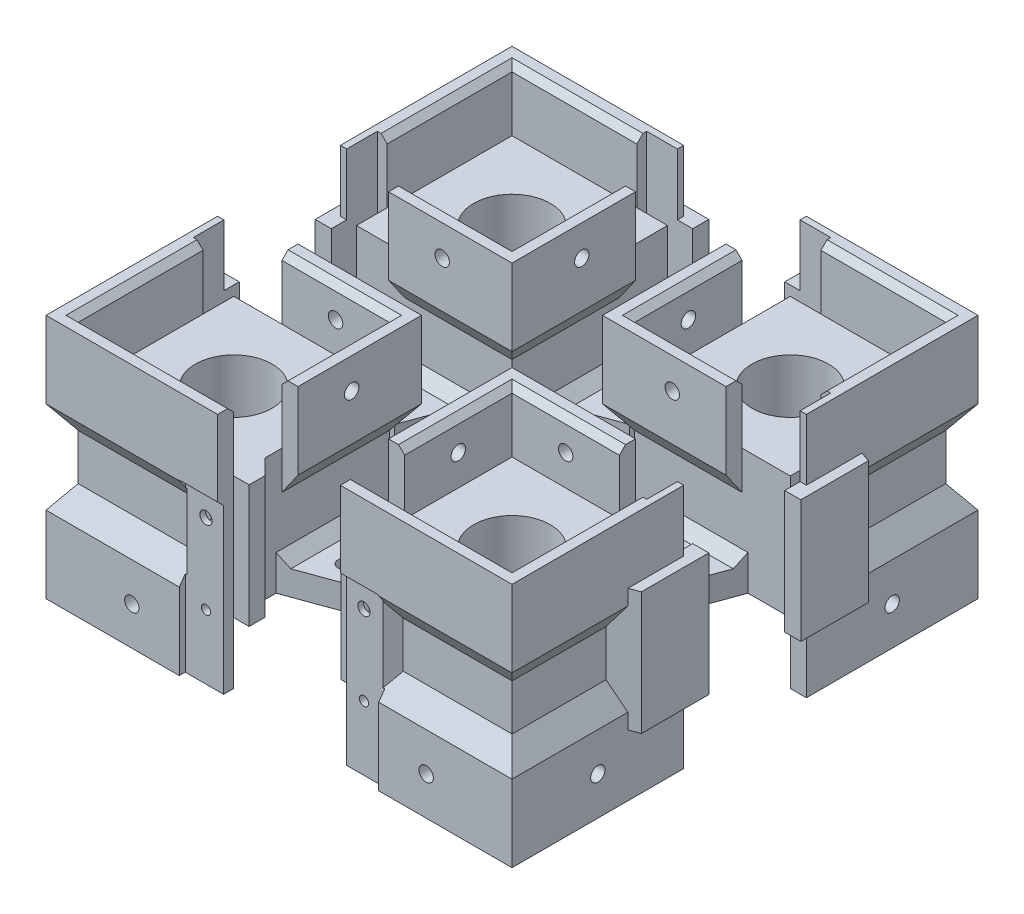
from build123d import *

# Parameters (mm, degrees)
SKETCH1_R                = 12.5
BOSS_EXTRUDE2_DEPTH      = 40
BOSS_EXTRUDE2_2_DEPTH    = 40
BOSS_EXTRUDE2_3_DEPTH    = 40
BOSS_EXTRUDE2_4_DEPTH    = 40
SKETCH1_7_R              = 2.35
BOSS_EXTRUDE3_DEPTH      = 8
BOSS_EXTRUDE4_DEPTH      = 20
BOSS_EXTRUDE4_DEPTH_BACK = 5
BOSS_EXTRUDE5_DEPTH      = 20
BOSS_EXTRUDE5_DEPTH_BACK = 5
CUT_EXTRUDE1_DEPTH       = 185.460022769
CUT_EXTRUDE1_DEPTH_BACK  = 10
SKETCH3_W                = 10
SKETCH3_H                = 3.2
SKETCH3_W_2              = 3.2
SKETCH3_H_2              = 10
CHAMFER5_SIZE            = 7.497777035
CHAMFER5_SIZE_2          = 5.25
CHAMFER6_SIZE            = 5.25
CHAMFER6_SIZE_2          = 7.497777035
CHAMFER7_SIZE            = 5.25
CHAMFER7_SIZE_2          = 7.497777035
CHAMFER8_SIZE            = 7.497777035
CHAMFER8_SIZE_2          = 5.25
CUT_EXTRUDE2_REACH       = 172.091
SKETCH6_R                = 2.35
CUT_EXTRUDE9_DEPTH       = 171.091071194
CUT_EXTRUDE9_DEPTH_BACK  = 171.091071194
SKETCH6_3_R              = 2.35
CUT_EXTRUDE3_REACH       = 172.091
SKETCH7_R                = 2.35
CUT_EXTRUDE10_DEPTH      = 171.091071194
CUT_EXTRUDE10_DEPTH_BACK = 171.091071194
SKETCH7_2_R              = 2.35
CUT_EXTRUDE4_START       = -3.75
CUT_EXTRUDE4_DEPTH       = 2.7
SKETCH8_3_R              = 2
CUT_EXTRUDE5_DEPTH       = 10
SKETCH8_7_R              = 1.5
CUT_EXTRUDE12_DEPTH      = 5
SKETCH9_W                = 65
SKETCH9_H                = 55.25
CUT_EXTRUDE8_DEPTH       = 1.95
CHAMFER9_SIZE            = 1.95
CHAMFER10_SIZE           = 1.95
CHAMFER11_SIZE           = 3.5
CHAMFER12_SIZE           = 3.5
CHAMFER13_SIZE           = 3.5
CHAMFER14_SIZE           = 3.5
CHAMFER15_SIZE           = 2
CHAMFER16_SIZE           = 2
CHAMFER17_SIZE           = 2
CHAMFER18_SIZE           = 2


# Some blends are built 0.0001 mm under size
with BuildPart() as part:
    # Sketch1 → Boss-Extrude2 (new body)
    with BuildSketch(Plane(origin=(0, 0, 0), x_dir=(1, 0, 0), z_dir=(0, 1, 0))):
        Polygon((15.35, 119.25), (15.35, 116.05), (25.35, 116.05), (25.35, 105.8), (25.35, 65.35), (-25.35, 65.35), (-25.35, 75.35), (-28.55, 75.35), (-28.55, 60.35), (-33.8, 60.35), (-33.8, 82.35), (-25.35, 85.42554848), (-25.35, 116.05), (5.27445152, 116.05), (8.35, 124.5), (30.35, 124.5), (30.35, 119.25), align=None)
        with Locations(Location((0, 90.7, 0), (0, 0, 270))):
            Circle(SKETCH1_R, mode=Mode.SUBTRACT)
    extrude(amount=BOSS_EXTRUDE2_DEPTH)



with BuildPart() as body_2:
    # Sketch1 → Boss-Extrude2 2 (new body)
    with BuildSketch(Plane(origin=(0, 0, 0), x_dir=(1, 0, 0), z_dir=(0, 1, 0))):
        Polygon((75.35, 116.05), (65.35, 116.05), (65.35, 105.8), (65.35, 65.35), (116.05, 65.35), (116.05, 75.35), (119.25, 75.35), (119.25, 60.35), (124.5, 60.35), (124.5, 82.35), (116.05, 85.42554848), (116.05, 116.05), (85.42554848, 116.05), (82.35, 124.5), (60.35, 124.5), (60.35, 119.25), (75.35, 119.25), align=None)
        with Locations(Location((90.7, 90.7, 0), (0, 0, 270))):
            Circle(SKETCH1_R, mode=Mode.SUBTRACT)
    extrude(amount=BOSS_EXTRUDE2_2_DEPTH)


with BuildPart() as body_3:
    # Sketch1 → Boss-Extrude2 3 (new body)
    with BuildSketch(Plane(origin=(0, 0, 0), x_dir=(1, 0, 0), z_dir=(0, 1, 0))):
        Polygon((-25.35, 15.35), (-25.35, 25.35), (25.35, 25.35), (25.35, -15.1), (30.35, -20.1), (30.35, -25.35), (25.35, -25.35), (25.35, -30.6), (15.35, -30.6), (10.1, -25.35), (-25.35, -25.35), (-25.35, 5.27445152), (-33.8, 8.35), (-33.8, 30.35), (-28.55, 30.35), (-28.55, 15.35), align=None)
        with Locations(Location((0, 0, 0), (0, 0, 270))):
            Circle(SKETCH1_R, mode=Mode.SUBTRACT)
    extrude(amount=BOSS_EXTRUDE2_3_DEPTH)


with BuildPart() as body_4:
    # Sketch1 → Boss-Extrude2 4 (new body)
    with BuildSketch(Plane(origin=(0, 0, 0), x_dir=(1, 0, 0), z_dir=(0, 1, 0))):
        Polygon((116.05, -25.35), (80.6, -25.35), (75.35, -30.6), (65.35, -30.6), (65.35, -25.35), (60.35, -25.35), (60.35, -20.1), (65.35, -15.1), (65.35, 25.35), (116.05, 25.35), (116.05, 15.35), (119.25, 15.35), (119.25, 30.35), (124.5, 30.35), (124.5, 8.35), (116.05, 5.27445152), align=None)
        with Locations(Location((90.7, 0, 0), (0, 0, 270))):
            Circle(SKETCH1_R, mode=Mode.SUBTRACT)
    extrude(amount=BOSS_EXTRUDE2_4_DEPTH)


with BuildPart() as part_1:
    add(part.part)

    add(body_2.part)  # Boss-Extrude3 merges body 2

    add(body_3.part)  # Boss-Extrude3 merges body 3

    add(body_4.part)  # Boss-Extrude3 merges body 4
    # Sketch1<7> → Boss-Extrude3 (add)
    # profile 1 of 8: a face of its own
    with BuildSketch(Plane(origin=(0, 0, 0), x_dir=(1, 0, 0), z_dir=(0, 1, 0))):
        Polygon((43.35, 95.7), (25.35, 102.251464217), (25.35, 79.148535783), (43.35, 85.7), align=None)
        with Locations(Location((36.35, 90.7, 0), (0, 0, 270))):
            Circle(SKETCH1_7_R, mode=Mode.SUBTRACT)
    # profile 2 of 8: a face of its own
    with BuildSketch(Plane(origin=(0, 0, 0), x_dir=(1, 0, 0), z_dir=(0, 1, 0))):
        Polygon((5, 47.35), (11.551464217, 65.35), (-11.551464217, 65.35), (-5, 47.35), align=None)
        with Locations(Location((0, 54.35, 0), (0, 0, 270))):
            Circle(SKETCH1_7_R, mode=Mode.SUBTRACT)
    # profile 3 of 8: a face of its own
    with BuildSketch(Plane(origin=(0, 0, 0), x_dir=(1, 0, 0), z_dir=(0, 1, 0))):
        Polygon((25.35, 11.551464217), (25.35, -11.551464217), (43.35, -5), (43.35, 5), align=None)
        with Locations(Location((36.35, 0, 0), (0, 0, 270))):
            Circle(SKETCH1_7_R, mode=Mode.SUBTRACT)
    # profile 4 of 8: a face of its own
    with BuildSketch(Plane(origin=(0, 0, 0), x_dir=(1, 0, 0), z_dir=(0, 1, 0))):
        Polygon((-5, 43.35), (-11.551464217, 25.35), (11.551464217, 25.35), (5, 43.35), align=None)
        with Locations(Location((0, 36.35, 0), (0, 0, 270))):
            Circle(SKETCH1_7_R, mode=Mode.SUBTRACT)
    # profile 5 of 8: a face of its own
    with BuildSketch(Plane(origin=(0, 0, 0), x_dir=(1, 0, 0), z_dir=(0, 1, 0))):
        Polygon((47.35, 5), (47.35, -5), (65.35, -11.551464217), (65.35, 11.551464217), align=None)
        with Locations(Location((54.35, 0, 0), (0, 0, 270))):
            Circle(SKETCH1_7_R, mode=Mode.SUBTRACT)
    # profile 6 of 8: a face of its own
    with BuildSketch(Plane(origin=(0, 0, 0), x_dir=(1, 0, 0), z_dir=(0, 1, 0))):
        Polygon((85.7, 43.35), (79.148535783, 25.35), (102.251464217, 25.35), (95.7, 43.35), align=None)
        with Locations(Location((90.7, 36.35, 0), (0, 0, 270))):
            Circle(SKETCH1_7_R, mode=Mode.SUBTRACT)
    # profile 7 of 8: a face of its own
    with BuildSketch(Plane(origin=(0, 0, 0), x_dir=(1, 0, 0), z_dir=(0, 1, 0))):
        Polygon((102.251464217, 65.35), (79.148535783, 65.35), (85.7, 47.35), (95.7, 47.35), align=None)
        with Locations(Location((90.7, 54.35, 0), (0, 0, 270))):
            Circle(SKETCH1_7_R, mode=Mode.SUBTRACT)
    # profile 8 of 8: a face of its own
    with BuildSketch(Plane(origin=(0, 0, 0), x_dir=(1, 0, 0), z_dir=(0, 1, 0))):
        Polygon((65.35, 79.148535783), (65.35, 102.251464217), (47.35, 95.7), (47.35, 85.7), align=None)
        with Locations(Location((54.35, 90.7, 0), (0, 0, 270))):
            Circle(SKETCH1_7_R, mode=Mode.SUBTRACT)
    extrude(amount=BOSS_EXTRUDE3_DEPTH)

    # Sketch2 → Boss-Extrude4 (add, two sides: drawn at the far end of the back side and taken through both)
    with BuildSketch(Plane.XZ.offset(-BOSS_EXTRUDE4_DEPTH_BACK)):
        Polygon((25.35, 30.6), (25.35, 25.35), (-25.35, 25.35), (-25.35, -25.35), (-30.6, -25.35), (-30.6, 30.6), align=None)
        Polygon((-25.35, -116.05), (-25.35, -65.35), (-30.6, -65.35), (-30.6, -121.3), (25.35, -121.3), (25.35, -116.05), align=None)
        Polygon((65.35, -121.3), (65.35, -116.05), (116.05, -116.05), (116.05, -65.35), (121.3, -65.35), (121.3, -121.3), align=None)
        Polygon((116.05, 25.35), (116.05, -25.35), (121.3, -25.35), (121.3, 30.6), (65.35, 30.6), (65.35, 25.35), align=None)
    extrude(amount=BOSS_EXTRUDE4_DEPTH + BOSS_EXTRUDE4_DEPTH_BACK)

    # Sketch4 → Boss-Extrude5 (add, two sides: drawn at the far end of the back side and taken through both)
    with BuildSketch(Plane(origin=(0, 40, 0), x_dir=(1, 0, 0), z_dir=(0, 1, 0)).offset(-BOSS_EXTRUDE5_DEPTH_BACK)):
        Polygon((-25.35, -25.35), (-25.35, 5.27445152), (-30.6, 7.18529525), (-30.6, -30.6), (15.35, -30.6), (10.1, -25.35), align=None)
        Polygon((-28.55, 15.35), (-28.55, 25.35), (-30.6, 25.35), (-30.6, 7.18529525), (-25.35, 5.27445152), (-25.35, 15.35), align=None)
        Polygon((25.35, -25.35), (10.1, -25.35), (15.35, -30.6), (25.35, -30.6), align=None)
        Polygon((25.35, 25.35), (25.35, -9.65), (30.6, -9.65), (30.6, 30.6), (-9.65, 30.6), (-9.65, 25.35), align=None)
        Polygon((25.35, 100.35), (30.6, 100.35), (30.6, 60.1), (-9.65, 60.1), (-9.65, 65.35), (25.35, 65.35), align=None)
        Polygon((-25.35, 65.35), (-25.35, 116.05), (25.35, 116.05), (25.35, 121.3), (-30.6, 121.3), (-30.6, 65.35), align=None)
        Polygon((65.35, -9.65), (60.1, -9.65), (60.1, 30.6), (100.35, 30.6), (100.35, 25.35), (65.35, 25.35), align=None)
        Polygon((116.05, 25.35), (116.05, -25.35), (65.35, -25.35), (65.35, -30.6), (121.3, -30.6), (121.3, 25.35), align=None)
        Polygon((100.35, 60.1), (100.35, 65.35), (65.35, 65.35), (65.35, 100.35), (60.1, 100.35), (60.1, 60.1), align=None)
        Polygon((121.3, 65.35), (121.3, 121.3), (65.35, 121.3), (65.35, 116.05), (116.05, 116.05), (116.05, 65.35), align=None)
    extrude(amount=BOSS_EXTRUDE5_DEPTH + BOSS_EXTRUDE5_DEPTH_BACK)

    # Sketch3 → Cut-Extrude1 (cut, two sides: drawn at the far end of the back side and taken through both)
    with BuildSketch(Plane(origin=(0, 5, 0), x_dir=(1, 0, 0), z_dir=(0, 1, 0)).offset(-CUT_EXTRUDE1_DEPTH_BACK)):
        with Locations((20.35, 117.65)):
            Rectangle(SKETCH3_W, SKETCH3_H)
        with Locations((-26.95, 70.35)):
            Rectangle(SKETCH3_W_2, SKETCH3_H_2)
        with Locations((-26.95, 20.35)):
            Rectangle(SKETCH3_W_2, SKETCH3_H_2)
        with Locations((117.65, 20.35)):
            Rectangle(SKETCH3_W_2, SKETCH3_H_2)
        with Locations((117.65, 70.35)):
            Rectangle(SKETCH3_W_2, SKETCH3_H_2)
        with Locations((70.35, 117.65)):
            Rectangle(SKETCH3_W, SKETCH3_H)
    extrude(amount=CUT_EXTRUDE1_DEPTH + CUT_EXTRUDE1_DEPTH_BACK, mode=Mode.SUBTRACT)

    # Chamfer5
    # the kernel refuses this chamfer: 7.497777035, 5.25 mm, written as the material it adds along each edge
    with BuildSketch(Plane(origin=(-25.35, 35, -66.062147675), x_dir=(0, -1, 0), z_dir=(0, 0, -1))) as chamfer5_piece_1_section:
        Polygon((CHAMFER5_SIZE, 0), (0, CHAMFER5_SIZE_2), (0, 0), align=None)
    chamfer5_piece_1 = extrude(amount=69.35125313, mode=Mode.PRIVATE)
    chamfer5_piece_1 = split(chamfer5_piece_1, bisect_by=Plane(origin=(-25.35, 35, -75.35), z_dir=(0, 0, -1)), keep=Keep.TOP, mode=Mode.PRIVATE)
    chamfer5_piece_1 = split(chamfer5_piece_1, bisect_by=Plane(origin=(-25.35, 9.046698891, -103.127302922), z_dir=(0, 0.5735764363510435, 0.8191520442889937)), keep=Keep.TOP, mode=Mode.PRIVATE)
    add(chamfer5_piece_1)
    with BuildSketch(Plane(origin=(-44.713400805, 35, -116.05), x_dir=(0, -1, 0), z_dir=(1, 0, 0))) as chamfer5_piece_2_section:
        Polygon((CHAMFER5_SIZE, 0), (0, CHAMFER5_SIZE_2), (0, 0), align=None)
    chamfer5_piece_2 = extrude(amount=69.35125313, mode=Mode.PRIVATE)
    chamfer5_piece_2 = split(chamfer5_piece_2, bisect_by=Plane(origin=(15.35, 35, -116.05), z_dir=(-1, 0, 0)), keep=Keep.TOP, mode=Mode.PRIVATE)
    chamfer5_piece_2 = split(chamfer5_piece_2, bisect_by=Plane(origin=(-35.243166719, 41.631129295, -116.05), z_dir=(0.8191520442889937, 0.5735764363510435, 0)), keep=Keep.TOP, mode=Mode.PRIVATE)
    add(chamfer5_piece_2)
    with BuildSketch(Plane(origin=(24.637852325, 5, -116.05), x_dir=(0, 0, -1), z_dir=(-1, 0, 0))) as chamfer5_piece_3_section:
        Polygon((CHAMFER5_SIZE_2, 0), (0, -CHAMFER5_SIZE), (0, 0), align=None)
    chamfer5_piece_3 = extrude(amount=69.35125313, mode=Mode.PRIVATE)
    chamfer5_piece_3 = split(chamfer5_piece_3, bisect_by=Plane(origin=(15.35, 5, -116.05), z_dir=(-1, 0, 0)), keep=Keep.TOP, mode=Mode.PRIVATE)
    chamfer5_piece_3 = split(chamfer5_piece_3, bisect_by=Plane(origin=(-12.427302922, 30.953301109, -116.05), z_dir=(0.8191520442889938, -0.5735764363510434, 0)), keep=Keep.TOP, mode=Mode.PRIVATE)
    add(chamfer5_piece_3)
    with BuildSketch(Plane(origin=(-25.35, 5, -135.413400805), x_dir=(-1, 0, 0), z_dir=(0, 0, 1))) as chamfer5_piece_4_section:
        Polygon((CHAMFER5_SIZE_2, 0), (0, -CHAMFER5_SIZE), (0, 0), align=None)
    chamfer5_piece_4 = extrude(amount=69.35125313, mode=Mode.PRIVATE)
    chamfer5_piece_4 = split(chamfer5_piece_4, bisect_by=Plane(origin=(-25.35, 5, -75.35), z_dir=(0, 0, -1)), keep=Keep.TOP, mode=Mode.PRIVATE)
    chamfer5_piece_4 = split(chamfer5_piece_4, bisect_by=Plane(origin=(-25.35, -1.631129295, -125.943166719), z_dir=(0, -0.5735764363510434, 0.8191520442889938)), keep=Keep.TOP, mode=Mode.PRIVATE)
    add(chamfer5_piece_4)
    with BuildSketch(Plane(origin=(-9.65, 35, -65.35), x_dir=(0, 0, 1), z_dir=(1, 0, 0))) as chamfer5_piece_5_section:
        Polygon((CHAMFER5_SIZE_2, 0), (0, CHAMFER5_SIZE), (0, 0), align=None)
    chamfer5_piece_5 = extrude(amount=54.363400805, mode=Mode.PRIVATE)
    chamfer5_piece_5 = split(chamfer5_piece_5, bisect_by=Plane(origin=(17.358155384, 16.088686007, -65.35), z_dir=(-0.8191520442889962, 0.5735764363510398, 0)), keep=Keep.TOP, mode=Mode.PRIVATE)
    add(chamfer5_piece_5)
    with BuildSketch(Plane(origin=(25.35, 35, -45.986599195), x_dir=(1, 0, 0), z_dir=(0, 0, -1))) as chamfer5_piece_6_section:
        Polygon((CHAMFER5_SIZE_2, 0), (0, CHAMFER5_SIZE), (0, 0), align=None)
    chamfer5_piece_6 = extrude(amount=54.363400805, mode=Mode.PRIVATE)
    chamfer5_piece_6 = split(chamfer5_piece_6, bisect_by=Plane(origin=(25.35, 41.631129295, -55.456833281), z_dir=(0, 0.5735764363510445, -0.8191520442889929)), keep=Keep.TOP, mode=Mode.PRIVATE)
    add(chamfer5_piece_6)

    # Chamfer6
    # the kernel refuses this chamfer: 7.497777035, 5.25 mm, written as the material it adds along each edge
    with BuildSketch(Plane(origin=(116.05, 5, -135.413400805), x_dir=(1, 0, 0), z_dir=(0, 0, 1))) as chamfer6_piece_1_section:
        Polygon((CHAMFER6_SIZE, 0), (0, CHAMFER6_SIZE_2), (0, 0), align=None)
    chamfer6_piece_1 = extrude(amount=69.35125313, mode=Mode.PRIVATE)
    chamfer6_piece_1 = split(chamfer6_piece_1, bisect_by=Plane(origin=(116.05, 5, -75.35), z_dir=(0, 0, -1)), keep=Keep.TOP, mode=Mode.PRIVATE)
    chamfer6_piece_1 = split(chamfer6_piece_1, bisect_by=Plane(origin=(116.05, -1.631129295, -125.94316672), z_dir=(0, -0.5735764363593767, 0.8191520442831587)), keep=Keep.TOP, mode=Mode.PRIVATE)
    add(chamfer6_piece_1)
    with BuildSketch(Plane(origin=(66.062147675, 5, -116.05), x_dir=(0, 0, -1), z_dir=(1, 0, 0))) as chamfer6_piece_2_section:
        Polygon((CHAMFER6_SIZE, 0), (-CHAMFER6_SIZE_2 * 1.51589485099e-11, CHAMFER6_SIZE_2), (0, 0), align=None)
    chamfer6_piece_2 = extrude(amount=69.35125313, mode=Mode.PRIVATE)
    chamfer6_piece_2 = split(chamfer6_piece_2, bisect_by=Plane(origin=(75.35, 5, -116.05), z_dir=(1, 0, 0)), keep=Keep.TOP, mode=Mode.PRIVATE)
    chamfer6_piece_2 = split(chamfer6_piece_2, bisect_by=Plane(origin=(103.127302922, 30.953301109, -116.05), z_dir=(-0.8191520442889938, -0.5735764363510434, 0)), keep=Keep.TOP, mode=Mode.PRIVATE)
    add(chamfer6_piece_2)
    with BuildSketch(Plane(origin=(116.05, 35, -135.413400805), x_dir=(1, 0, 0), z_dir=(0, 0, 1))) as chamfer6_piece_3_section:
        Polygon((CHAMFER6_SIZE, 0), (0, -CHAMFER6_SIZE_2), (0, 0), align=None)
    chamfer6_piece_3 = extrude(amount=69.35125313, mode=Mode.PRIVATE)
    chamfer6_piece_3 = split(chamfer6_piece_3, bisect_by=Plane(origin=(116.05, 35, -75.35), z_dir=(0, 0, -1)), keep=Keep.TOP, mode=Mode.PRIVATE)
    chamfer6_piece_3 = split(chamfer6_piece_3, bisect_by=Plane(origin=(116.05, 41.631129295, -125.94316672), z_dir=(0, 0.5735764363593768, 0.8191520442831587)), keep=Keep.TOP, mode=Mode.PRIVATE)
    add(chamfer6_piece_3)
    with BuildSketch(Plane(origin=(66.062147675, 35, -116.05), x_dir=(0, 0, -1), z_dir=(1, 0, 0))) as chamfer6_piece_4_section:
        Polygon((CHAMFER6_SIZE, 0), (-CHAMFER6_SIZE_2 * 1.51589485099e-11, -CHAMFER6_SIZE_2), (0, 0), align=None)
    chamfer6_piece_4 = extrude(amount=69.35125313, mode=Mode.PRIVATE)
    chamfer6_piece_4 = split(chamfer6_piece_4, bisect_by=Plane(origin=(75.35, 35, -116.05), z_dir=(1, 0, 0)), keep=Keep.TOP, mode=Mode.PRIVATE)
    chamfer6_piece_4 = split(chamfer6_piece_4, bisect_by=Plane(origin=(103.127302922, 9.046698891, -116.05), z_dir=(-0.8191520442889937, 0.5735764363510435, 0)), keep=Keep.TOP, mode=Mode.PRIVATE)
    add(chamfer6_piece_4)
    with BuildSketch(Plane(origin=(65.35, 35, -45.986599195), x_dir=(-1, 0, 0), z_dir=(0, 0, -1))) as chamfer6_piece_5_section:
        Polygon((CHAMFER6_SIZE, 0), (0, -CHAMFER6_SIZE_2), (0, 0), align=None)
    chamfer6_piece_5 = extrude(amount=54.363400805, mode=Mode.PRIVATE)
    chamfer6_piece_5 = split(chamfer6_piece_5, bisect_by=Plane(origin=(65.35, 41.631129295, -55.456833281), z_dir=(0, 0.5735764363510456, -0.8191520442889922)), keep=Keep.TOP, mode=Mode.PRIVATE)
    add(chamfer6_piece_5)
    with BuildSketch(Plane(origin=(100.35, 35, -65.35), x_dir=(0, 0, 1), z_dir=(-1, 0, 0))) as chamfer6_piece_6_section:
        Polygon((CHAMFER6_SIZE, 0), (0, -CHAMFER6_SIZE_2), (0, 0), align=None)
    chamfer6_piece_6 = extrude(amount=54.363400805, mode=Mode.PRIVATE)
    chamfer6_piece_6 = split(chamfer6_piece_6, bisect_by=Plane(origin=(73.341844616, 16.088686007, -65.35), z_dir=(0.8191520442889944, 0.5735764363510424, 0)), keep=Keep.TOP, mode=Mode.PRIVATE)
    add(chamfer6_piece_6)

    # Chamfer7
    # the kernel refuses this chamfer: 7.497777035, 5.25 mm, written as the material it adds along each edge
    with BuildSketch(Plane(origin=(116.05, 35, -24.637852325), x_dir=(1, 0, 0), z_dir=(0, 0, 1))) as chamfer7_piece_1_section:
        Polygon((CHAMFER7_SIZE, 0), (0, -CHAMFER7_SIZE_2), (0, 0), align=None)
    chamfer7_piece_1 = extrude(amount=69.35125313, mode=Mode.PRIVATE)
    chamfer7_piece_1 = split(chamfer7_piece_1, bisect_by=Plane(origin=(116.05, 35, -15.35), z_dir=(0, 0, 1)), keep=Keep.TOP, mode=Mode.PRIVATE)
    chamfer7_piece_1 = split(chamfer7_piece_1, bisect_by=Plane(origin=(116.05, 9.046698891, 12.427302922), z_dir=(0, 0.5735764363427109, -0.8191520442948282)), keep=Keep.TOP, mode=Mode.PRIVATE)
    add(chamfer7_piece_1)
    with BuildSketch(Plane(origin=(135.413400805, 35, 25.35), x_dir=(0, 0, 1), z_dir=(-1, 0, 0))) as chamfer7_piece_2_section:
        Polygon((CHAMFER7_SIZE, 0), (CHAMFER7_SIZE_2 * 1.51608438523e-11, -CHAMFER7_SIZE_2), (0, 0), align=None)
    chamfer7_piece_2 = extrude(amount=74.17680161, mode=Mode.PRIVATE)
    chamfer7_piece_2 = split(chamfer7_piece_2, bisect_by=Plane(origin=(65.35, 35, 25.35), z_dir=(1, 0, 0)), keep=Keep.TOP, mode=Mode.PRIVATE)
    chamfer7_piece_2 = split(chamfer7_piece_2, bisect_by=Plane(origin=(125.943166719, 41.631129295, 25.35), z_dir=(-0.8191520442889922, 0.5735764363510456, 0)), keep=Keep.TOP, mode=Mode.PRIVATE)
    add(chamfer7_piece_2)
    with BuildSketch(Plane(origin=(116.05, 5, 44.713400805), x_dir=(0, 1, 0), z_dir=(0, 0, -1))) as chamfer7_piece_3_section:
        Polygon((CHAMFER7_SIZE_2, 0), (0, CHAMFER7_SIZE), (0, 0), align=None)
    chamfer7_piece_3 = extrude(amount=69.35125313, mode=Mode.PRIVATE)
    chamfer7_piece_3 = split(chamfer7_piece_3, bisect_by=Plane(origin=(116.05, 5, -15.35), z_dir=(0, 0, 1)), keep=Keep.TOP, mode=Mode.PRIVATE)
    chamfer7_piece_3 = split(chamfer7_piece_3, bisect_by=Plane(origin=(116.05, -1.631129295, 35.243166719), z_dir=(0, -0.5735764363427114, -0.8191520442948279)), keep=Keep.TOP, mode=Mode.PRIVATE)
    add(chamfer7_piece_3)
    with BuildSketch(Plane(origin=(61.236599195, 5, 25.35), x_dir=(0, 0, 1), z_dir=(1, 0, 0))) as chamfer7_piece_4_section:
        Polygon((CHAMFER7_SIZE, 0), (CHAMFER7_SIZE_2 * 1.51608438523e-11, -CHAMFER7_SIZE_2), (0, 0), align=None)
    chamfer7_piece_4 = extrude(amount=74.17680161, mode=Mode.PRIVATE)
    chamfer7_piece_4 = split(chamfer7_piece_4, bisect_by=Plane(origin=(65.35, 5, 25.35), z_dir=(1, 0, 0)), keep=Keep.TOP, mode=Mode.PRIVATE)
    chamfer7_piece_4 = split(chamfer7_piece_4, bisect_by=Plane(origin=(101.539746073, 33.220567258, 25.35), z_dir=(-0.8191520442889924, -0.5735764363510455, 0)), keep=Keep.TOP, mode=Mode.PRIVATE)
    add(chamfer7_piece_4)
    with BuildSketch(Plane(origin=(65.35, 35, -44.713400805), x_dir=(-1, 0, 0), z_dir=(0, 0, 1))) as chamfer7_piece_5_section:
        Polygon((CHAMFER7_SIZE, 0), (0, CHAMFER7_SIZE_2), (0, 0), align=None)
    chamfer7_piece_5 = extrude(amount=54.363400805, mode=Mode.PRIVATE)
    chamfer7_piece_5 = split(chamfer7_piece_5, bisect_by=Plane(origin=(65.35, 41.631129295, -35.243166719), z_dir=(0, 0.5735764363510442, 0.8191520442889931)), keep=Keep.TOP, mode=Mode.PRIVATE)
    add(chamfer7_piece_5)
    with BuildSketch(Plane(origin=(100.35, 35, -25.35), x_dir=(0, 0, -1), z_dir=(-1, 0, 0))) as chamfer7_piece_6_section:
        Polygon((CHAMFER7_SIZE, 0), (0, CHAMFER7_SIZE_2), (0, 0), align=None)
    chamfer7_piece_6 = extrude(amount=54.363400805, mode=Mode.PRIVATE)
    chamfer7_piece_6 = split(chamfer7_piece_6, bisect_by=Plane(origin=(73.341844616, 16.088686007, -25.35), z_dir=(0.8191520442889929, 0.5735764363510445, 0)), keep=Keep.TOP, mode=Mode.PRIVATE)
    add(chamfer7_piece_6)

    # Chamfer8
    # the kernel refuses this chamfer: 7.497777035, 5.25 mm, written as the material it adds along each edge
    with BuildSketch(Plane(origin=(-25.35, 5, 44.713400805), x_dir=(0, 1, 0), z_dir=(0, 0, -1))) as chamfer8_piece_1_section:
        Polygon((CHAMFER8_SIZE, 0), (0, -CHAMFER8_SIZE_2), (0, 0), align=None)
    chamfer8_piece_1 = extrude(amount=69.35125313, mode=Mode.PRIVATE)
    chamfer8_piece_1 = split(chamfer8_piece_1, bisect_by=Plane(origin=(-25.35, 5, -15.35), z_dir=(0, 0, 1)), keep=Keep.TOP, mode=Mode.PRIVATE)
    chamfer8_piece_1 = split(chamfer8_piece_1, bisect_by=Plane(origin=(-25.35, -1.631129295, 35.243166719), z_dir=(0, -0.5735764363510445, -0.8191520442889929)), keep=Keep.TOP, mode=Mode.PRIVATE)
    add(chamfer8_piece_1)
    with BuildSketch(Plane(origin=(29.463400805, 5, 25.35), x_dir=(0, 1, 0), z_dir=(-1, 0, 0))) as chamfer8_piece_2_section:
        Polygon((CHAMFER8_SIZE, 0), (0, -CHAMFER8_SIZE_2), (0, 0), align=None)
    chamfer8_piece_2 = extrude(amount=74.17680161, mode=Mode.PRIVATE)
    chamfer8_piece_2 = split(chamfer8_piece_2, bisect_by=Plane(origin=(19.781700402, 5, 35.031700402), z_dir=(-0.7071067811865436, 0, 0.7071067811865515)), keep=Keep.TOP, mode=Mode.PRIVATE)
    chamfer8_piece_2 = split(chamfer8_piece_2, bisect_by=Plane(origin=(-10.839746073, 33.220567258, 25.35), z_dir=(0.8191520442889929, -0.5735764363510445, 0)), keep=Keep.TOP, mode=Mode.PRIVATE)
    add(chamfer8_piece_2)
    with BuildSketch(Plane(origin=(-25.35, 35, -24.637852325), x_dir=(0, -1, 0), z_dir=(0, 0, 1))) as chamfer8_piece_3_section:
        Polygon((CHAMFER8_SIZE, 0), (0, -CHAMFER8_SIZE_2), (0, 0), align=None)
    chamfer8_piece_3 = extrude(amount=69.35125313, mode=Mode.PRIVATE)
    chamfer8_piece_3 = split(chamfer8_piece_3, bisect_by=Plane(origin=(-25.35, 35, -15.35), z_dir=(0, 0, 1)), keep=Keep.TOP, mode=Mode.PRIVATE)
    chamfer8_piece_3 = split(chamfer8_piece_3, bisect_by=Plane(origin=(-25.35, 9.046698891, 12.427302922), z_dir=(0, 0.5735764363510445, -0.8191520442889929)), keep=Keep.TOP, mode=Mode.PRIVATE)
    add(chamfer8_piece_3)
    with BuildSketch(Plane(origin=(-44.713400805, 35, 25.35), x_dir=(0, -1, 0), z_dir=(1, 0, 0))) as chamfer8_piece_4_section:
        Polygon((CHAMFER8_SIZE, 0), (0, -CHAMFER8_SIZE_2), (0, 0), align=None)
    chamfer8_piece_4 = extrude(amount=74.17680161, mode=Mode.PRIVATE)
    chamfer8_piece_4 = split(chamfer8_piece_4, bisect_by=Plane(origin=(-17.306700402, 35, -2.056700402), z_dir=(-0.7071067811865436, 0, 0.7071067811865515)), keep=Keep.TOP, mode=Mode.PRIVATE)
    chamfer8_piece_4 = split(chamfer8_piece_4, bisect_by=Plane(origin=(-35.243166719, 41.631129295, 25.35), z_dir=(0.8191520442889929, 0.5735764363510445, 0)), keep=Keep.TOP, mode=Mode.PRIVATE)
    add(chamfer8_piece_4)
    with BuildSketch(Plane(origin=(-9.65, 35, -25.35), x_dir=(0, 0, -1), z_dir=(1, 0, 0))) as chamfer8_piece_5_section:
        Polygon((CHAMFER8_SIZE_2, 0), (0, -CHAMFER8_SIZE), (0, 0), align=None)
    chamfer8_piece_5 = extrude(amount=54.363400805, mode=Mode.PRIVATE)
    chamfer8_piece_5 = split(chamfer8_piece_5, bisect_by=Plane(origin=(17.358155384, 16.088686007, -25.35), z_dir=(-0.8191520442889929, 0.5735764363510445, 0)), keep=Keep.TOP, mode=Mode.PRIVATE)
    add(chamfer8_piece_5)
    with BuildSketch(Plane(origin=(25.35, 35, -44.713400805), x_dir=(1, 0, 0), z_dir=(0, 0, 1))) as chamfer8_piece_6_section:
        Polygon((CHAMFER8_SIZE_2, 0), (0, -CHAMFER8_SIZE), (0, 0), align=None)
    chamfer8_piece_6 = extrude(amount=54.363400805, mode=Mode.PRIVATE)
    chamfer8_piece_6 = split(chamfer8_piece_6, bisect_by=Plane(origin=(25.35, 41.631129295, -35.243166719), z_dir=(0, 0.5735764363510445, 0.8191520442889929)), keep=Keep.TOP, mode=Mode.PRIVATE)
    add(chamfer8_piece_6)

    # Cut-Extrude2: up to this face of the body (flat: up to its plane)
    cut_extrude2_end = Plane(part_1.part.faces().sort_by_distance((82.85, 50, -65.35))[0])
    # Sketch6 → Cut-Extrude2 (cut, up to the picked face)
    with BuildSketch(Plane.XY.offset(-25.35), mode=Mode.PRIVATE) as cut_extrude2_sk1:
        with Locations((7.85, 50)):
            Circle(SKETCH6_R)
    cut_extrude2_tool1 = split(extrude(cut_extrude2_sk1.sketch, amount=-CUT_EXTRUDE2_REACH, mode=Mode.PRIVATE), bisect_by=cut_extrude2_end, keep=Keep.BOTH, mode=Mode.PRIVATE)
    # Sketch6 → Cut-Extrude2 (cut, up to the picked face)
    with BuildSketch(Plane.XY.offset(-25.35), mode=Mode.PRIVATE) as cut_extrude2_sk2:
        with Locations((82.85, 50)):
            Circle(SKETCH6_R)
    cut_extrude2_tool2 = split(extrude(cut_extrude2_sk2.sketch, amount=-CUT_EXTRUDE2_REACH, mode=Mode.PRIVATE), bisect_by=cut_extrude2_end, keep=Keep.BOTH, mode=Mode.PRIVATE)
    # Sketch6 → Cut-Extrude2 (cut, up to the picked face)
    with BuildSketch(Plane.XY.offset(-25.35), mode=Mode.PRIVATE) as cut_extrude2_sk3:
        with Locations((-2.625, -7.5)):
            Circle(SKETCH6_R)
    cut_extrude2_tool3 = split(extrude(cut_extrude2_sk3.sketch, amount=-CUT_EXTRUDE2_REACH, mode=Mode.PRIVATE), bisect_by=cut_extrude2_end, keep=Keep.BOTH, mode=Mode.PRIVATE)
    # Sketch6 → Cut-Extrude2 (cut, up to the picked face)
    with BuildSketch(Plane.XY.offset(-25.35), mode=Mode.PRIVATE) as cut_extrude2_sk4:
        with Locations((93.325, -7.5)):
            Circle(SKETCH6_R)
    cut_extrude2_tool4 = split(extrude(cut_extrude2_sk4.sketch, amount=-CUT_EXTRUDE2_REACH, mode=Mode.PRIVATE), bisect_by=cut_extrude2_end, keep=Keep.BOTH, mode=Mode.PRIVATE)
    add(cut_extrude2_tool1.solids().sort_by(Axis((7.85, 50, -25.35), (0, 0, -1)))[0], mode=Mode.SUBTRACT)
    add(cut_extrude2_tool2.solids().sort_by(Axis((82.85, 50, -25.35), (0, 0, -1)))[0], mode=Mode.SUBTRACT)
    add(cut_extrude2_tool3.solids().sort_by(Axis((-2.625, -7.5, -25.35), (0, 0, -1)))[0], mode=Mode.SUBTRACT)
    add(cut_extrude2_tool4.solids().sort_by(Axis((93.325, -7.5, -25.35), (0, 0, -1)))[0], mode=Mode.SUBTRACT)

    # Sketch6<3> → Cut-Extrude9 (cut, two sides: drawn at the far end of the back side and taken through both)
    with BuildSketch(Plane.XY.offset(-25.35).offset(-CUT_EXTRUDE9_DEPTH_BACK)):
        with Locations((-2.625, -7.5)):
            Circle(SKETCH6_3_R)
        with Locations((93.325, -7.5)):
            Circle(SKETCH6_3_R)
    extrude(amount=CUT_EXTRUDE9_DEPTH + CUT_EXTRUDE9_DEPTH_BACK, mode=Mode.SUBTRACT)

    # Cut-Extrude3: up to this face of the body (flat: up to its plane)
    cut_extrude3_end = Plane(part_1.part.faces().sort_by_distance((25.35, 50, -7.85))[0])
    # Sketch7 → Cut-Extrude3 (cut, up to the picked face)
    with BuildSketch(Plane(origin=(65.35, 0, 0), x_dir=(0, 0, -1), z_dir=(1, 0, 0)), mode=Mode.PRIVATE) as cut_extrude3_sk1:
        with Locations((7.85, 50)):
            Circle(SKETCH7_R)
    cut_extrude3_tool1 = split(extrude(cut_extrude3_sk1.sketch, amount=-CUT_EXTRUDE3_REACH, mode=Mode.PRIVATE), bisect_by=cut_extrude3_end, keep=Keep.BOTH, mode=Mode.PRIVATE)
    # Sketch7 → Cut-Extrude3 (cut, up to the picked face)
    with BuildSketch(Plane(origin=(65.35, 0, 0), x_dir=(0, 0, -1), z_dir=(1, 0, 0)), mode=Mode.PRIVATE) as cut_extrude3_sk2:
        with Locations((82.85, 50)):
            Circle(SKETCH7_R)
    cut_extrude3_tool2 = split(extrude(cut_extrude3_sk2.sketch, amount=-CUT_EXTRUDE3_REACH, mode=Mode.PRIVATE), bisect_by=cut_extrude3_end, keep=Keep.BOTH, mode=Mode.PRIVATE)
    # Sketch7 → Cut-Extrude3 (cut, up to the picked face)
    with BuildSketch(Plane(origin=(65.35, 0, 0), x_dir=(0, 0, -1), z_dir=(1, 0, 0)), mode=Mode.PRIVATE) as cut_extrude3_sk3:
        with Locations((-2.625, -7.5)):
            Circle(SKETCH7_R)
    cut_extrude3_tool3 = split(extrude(cut_extrude3_sk3.sketch, amount=-CUT_EXTRUDE3_REACH, mode=Mode.PRIVATE), bisect_by=cut_extrude3_end, keep=Keep.BOTH, mode=Mode.PRIVATE)
    # Sketch7 → Cut-Extrude3 (cut, up to the picked face)
    with BuildSketch(Plane(origin=(65.35, 0, 0), x_dir=(0, 0, -1), z_dir=(1, 0, 0)), mode=Mode.PRIVATE) as cut_extrude3_sk4:
        with Locations((93.325, -7.5)):
            Circle(SKETCH7_R)
    cut_extrude3_tool4 = split(extrude(cut_extrude3_sk4.sketch, amount=-CUT_EXTRUDE3_REACH, mode=Mode.PRIVATE), bisect_by=cut_extrude3_end, keep=Keep.BOTH, mode=Mode.PRIVATE)
    add(cut_extrude3_tool1.solids().sort_by(Axis((65.35, 50, -7.85), (-1, 0, 0)))[0], mode=Mode.SUBTRACT)
    add(cut_extrude3_tool2.solids().sort_by(Axis((65.35, 50, -82.85), (-1, 0, 0)))[0], mode=Mode.SUBTRACT)
    add(cut_extrude3_tool3.solids().sort_by(Axis((65.35, -7.5, 2.625), (-1, 0, 0)))[0], mode=Mode.SUBTRACT)
    add(cut_extrude3_tool4.solids().sort_by(Axis((65.35, -7.5, -93.325), (-1, 0, 0)))[0], mode=Mode.SUBTRACT)

    # Sketch7<2> → Cut-Extrude10 (cut, two sides: drawn at the far end of the back side and taken through both)
    with BuildSketch(Plane(origin=(65.35, 0, 0), x_dir=(0, 0, -1), z_dir=(1, 0, 0)).offset(-CUT_EXTRUDE10_DEPTH_BACK)):
        with Locations((-2.625, -7.5)):
            Circle(SKETCH7_2_R)
        with Locations((93.325, -7.5)):
            Circle(SKETCH7_2_R)
    extrude(amount=CUT_EXTRUDE10_DEPTH + CUT_EXTRUDE10_DEPTH_BACK, mode=Mode.SUBTRACT)

    # Sketch8 → Cut-Extrude4 (cut)
    with BuildSketch(Plane.XY.offset(30.6).offset(CUT_EXTRUDE4_START)):
        Polygon((67.520428331, 30), (67.520428331, 27), (69.310214166, 23.9), (72.889785834, 23.9), (74.679571669, 27), (74.679571669, 30), align=None)
        Polygon((23.179571669, 27), (23.179571669, 30.1), (21.389785834, 30.1), (21.447520861, 30), (17.752479139, 30), (17.810214166, 30.1), (16.020428331, 30.1), (16.020428331, 27), (17.810214166, 23.9), (21.389785834, 23.9), align=None)
    extrude(amount=-CUT_EXTRUDE4_DEPTH, mode=Mode.SUBTRACT)

    # Sketch8<3> → Cut-Extrude5 (cut)
    with BuildSketch(Plane.XY.offset(30.6)):
        with Locations((19.6, 27)):
            Circle(SKETCH8_3_R)
        with Locations((71.1, 27)):
            Circle(SKETCH8_3_R)
    extrude(amount=-CUT_EXTRUDE5_DEPTH, mode=Mode.SUBTRACT)

    # Sketch8<7> → Cut-Extrude12 (cut)
    with BuildSketch(Plane.XY.offset(30.6)):
        with Locations((71.1, 1)):
            Circle(SKETCH8_7_R)
        with Locations((19.6, 1)):
            Circle(SKETCH8_7_R)
    extrude(amount=-CUT_EXTRUDE12_DEPTH, mode=Mode.SUBTRACT)

    # Sketch9 → Cut-Extrude8 (cut)
    with BuildSketch(Plane.XY.offset(30.6)):
        with Locations((45.35, 7.625)):
            Rectangle(SKETCH9_W, SKETCH9_H)
    extrude(amount=-CUT_EXTRUDE8_DEPTH, mode=Mode.SUBTRACT)

    # Chamfer9
    chamfer9_edges = [part_1.edges().sort_by_distance(p)[0] for p in [
        (19.1, 35.25, 28.65),
    ]]
    chamfer(chamfer9_edges, length=CHAMFER9_SIZE - 0.0001)  # a hair under: the kernel refuses the full size

    # Chamfer10
    chamfer10_edges = [part_1.edges().sort_by_distance(p)[0] for p in [
        (71.6, 35.25, 28.65),
    ]]
    chamfer(chamfer10_edges, length=CHAMFER10_SIZE - 0.0001)  # a hair under: the kernel refuses the full size

    # Chamfer11
    chamfer11_edges = [part_1.edges().sort_by_distance(p)[0] for p in [
        (25.35, 8, -90.7),
        (0, 8, -65.35),
    ]]
    chamfer(chamfer11_edges, length=CHAMFER11_SIZE)

    # Chamfer12
    chamfer12_edges = [part_1.edges().sort_by_distance(p)[0] for p in [
        (90.7, 8, -65.35),
        (65.35, 8, -90.7),
    ]]
    chamfer(chamfer12_edges, length=CHAMFER12_SIZE)

    # Chamfer13
    chamfer13_edges = [part_1.edges().sort_by_distance(p)[0] for p in [
        (65.35, 8, 0),
        (90.7, 8, -25.35),
    ]]
    chamfer(chamfer13_edges, length=CHAMFER13_SIZE)

    # Chamfer14
    chamfer14_edges = [part_1.edges().sort_by_distance(p)[0] for p in [
        (25.35, 8, 0),
        (0, 8, -25.35),
    ]]
    chamfer(chamfer14_edges, length=CHAMFER14_SIZE)

    # Chamfer15
    chamfer15_edges = [part_1.edges().sort_by_distance(p)[0] for p in [
        (7.85, 60, -25.35),
        (25.35, 60, -7.85),
        (0, 60, 25.35),
        (-25.35, 60, 5),
    ]]
    chamfer(chamfer15_edges, length=CHAMFER15_SIZE)

    # Chamfer16
    chamfer16_edges = [part_1.edges().sort_by_distance(p)[0] for p in [
        (7.85, 60, -65.35),
        (25.35, 60, -82.85),
        (-5, 60, -116.05),
        (-25.35, 60, -95.7),
    ]]
    chamfer(chamfer16_edges, length=CHAMFER16_SIZE)

    # Chamfer17
    chamfer17_edges = [part_1.edges().sort_by_distance(p)[0] for p in [
        (82.85, 60, -65.35),
        (65.35, 60, -82.85),
        (116.05, 60, -95.7),
        (95.7, 60, -116.05),
    ]]
    chamfer(chamfer17_edges, length=CHAMFER17_SIZE)

    # Chamfer18
    chamfer18_edges = [part_1.edges().sort_by_distance(p)[0] for p in [
        (90.7, 60, 25.35),
        (116.05, 60, 5),
        (82.85, 60, -25.35),
        (65.35, 60, -7.85),
    ]]
    chamfer(chamfer18_edges, length=CHAMFER18_SIZE)


solid = part_1.part
